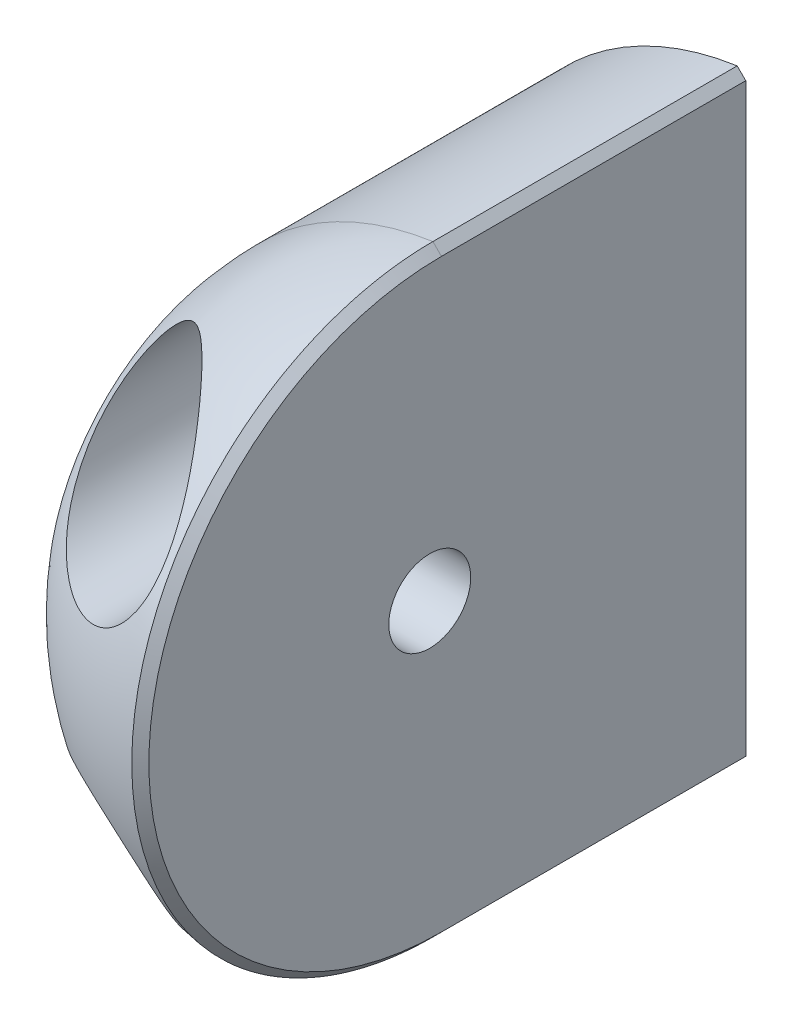
from build123d import *
from build123d.topology import SkipClean

# Parameters (mm, degrees)
REVOLU_O1_ANGLE            = 90
ESBO_O3_R                  = 2.5
CORTE_EXTRUS_O1_DEPTH      = 79.698792875
RESSALTO_EXTRUS_O1_START   = 13
ESBO_O7_R                  = 2.5
RESSALTO_EXTRUS_O1_DEPTH   = 13
CORTE_EXTRUS_O3_DEPTH      = 79.698792875
CORTE_EXTRUS_O3_DEPTH_BACK = 6.5
ESBO_O4_R                  = 3.5
ESBO_O6_R                  = 1.75
CORTE_EXTRUS_O4_DEPTH      = 71.924255371
CORTE_EXTRUS_O5_START      = -6.5
ESBO_O8_R                  = 3.1
CORTE_EXTRUS_O5_DEPTH      = 13
CHANFRO1_SIZE              = 2
CORTE_EXTRUS_O6_DEPTH      = 82.701335058
CORTE_EXTRUS_O7_DEPTH      = 81.405896153


with BuildPart() as part:
    # Esboço2 → Revolução1 (revolve)
    with BuildSketch(Plane.XY):
        with BuildLine():
            Line((-23.5, 42.5), (-23.5, 68.5))
            ThreePointArc((-23.5, 68.5), (-36.5, 55.5), (-23.5, 42.5))
        make_face()
    revolve(axis=Axis((-23.5, 42.5, 0), (0, 1, 0)), revolution_arc=REVOLU_O1_ANGLE)

    # Esboço3 → Corte-extrusão1 (cut, through all)
    with BuildSketch(Plane.XY):
        with Locations(Location((-29.2, 62, 0), (0, 0, 142.736397609))):
            Circle(ESBO_O3_R)
        with Locations(Location((-29.2, 49, 0), (0, 0, 233.94500715))):
            Circle(ESBO_O3_R)
    extrude(amount=CORTE_EXTRUS_O1_DEPTH, mode=Mode.SUBTRACT)

    # Esboço7 → Ressalto-extrusão1 (add)
    with SkipClean():  # the faces are left unmerged after this step: merging them gives an invalid solid
        with BuildSketch(Plane(origin=(0, 0, 0), x_dir=(-1, 0, 0), z_dir=(0, 0, -1)).offset(RESSALTO_EXTRUS_O1_START)):
            with BuildLine():
                Line((23.5, 68.5), (23.5, 42.5))
                ThreePointArc((23.5, 42.5), (36.5, 55.5), (23.5, 68.5))
            make_face()
            with Locations((29.2, 62)):
                Circle(ESBO_O7_R, mode=Mode.SUBTRACT)
            with Locations((29.2, 49)):
                Circle(ESBO_O7_R, mode=Mode.SUBTRACT)
        extrude(amount=-RESSALTO_EXTRUS_O1_DEPTH)

    # Esboço4 → Corte-extrusão3 (cut, two sides: drawn at the far end of the back side and taken through both)
    with BuildSketch(Plane.XY.offset(-CORTE_EXTRUS_O3_DEPTH_BACK)):
        with Locations((-29.2, 62)):
            Circle(ESBO_O4_R)
        with Locations((-29.2, 49)):
            Circle(ESBO_O4_R)
    extrude(amount=CORTE_EXTRUS_O3_DEPTH + CORTE_EXTRUS_O3_DEPTH_BACK, mode=Mode.SUBTRACT)

    # Esboço6 → Corte-extrusão4 (cut, through all)
    with BuildSketch(Plane(origin=(-23.5, 0, 0), x_dir=(0, 0, -1), z_dir=(1, 0, 0))):
        with Locations((-0.5, 55.5)):
            Circle(ESBO_O6_R)
    extrude(amount=-CORTE_EXTRUS_O4_DEPTH, mode=Mode.SUBTRACT)

    # Esboço8 → Corte-extrusão5 (cut)
    with BuildSketch(Plane(origin=(-23.5, 0, 0), x_dir=(0, 0, -1), z_dir=(1, 0, 0)).offset(CORTE_EXTRUS_O5_START)):
        with Locations(Location((-0.5, 55.5, 0), (0, 0, 279.281799091))):
            Circle(ESBO_O8_R)
    extrude(amount=-CORTE_EXTRUS_O5_DEPTH, mode=Mode.SUBTRACT)

    # Chanfro1
    # the kernel refuses this chamfer: 2 mm, written as the material it takes off along each edge
    with BuildSketch(Plane(origin=(-23.5, 42.5, -18.143365976), x_dir=(-0.9974093352150653, 0.07193481789677074, 0), z_dir=(0, 0, 1))) as chanfro1_piece_1:
        with BuildLine():
            Line((1.870305265, 0), (CHANFRO1_SIZE * 0.0719348178968, -CHANFRO1_SIZE * 0.997409335215))
            Line((CHANFRO1_SIZE * 0.0719348178968, -CHANFRO1_SIZE * 0.997409335215), (0, 0))
            ThreePointArc((0, 0), (0.961335866, 0.033652274), (1.870305265, 0))
        make_face()
    extrude(amount=18.143365976, mode=Mode.SUBTRACT)
    with BuildSketch(Plane(origin=(-23.5, 68.5, -18.143365976), x_dir=(-0.9974093352150653, -0.07193481789677116, 0), z_dir=(0, 0, 1))) as chanfro1_piece_2:
        with BuildLine():
            Line((1.870305265, 0), (CHANFRO1_SIZE * 0.0719348178968, CHANFRO1_SIZE * 0.997409335215))
            Line((CHANFRO1_SIZE * 0.0719348178968, CHANFRO1_SIZE * 0.997409335215), (0, 0))
            ThreePointArc((0, 0), (0.961335866, -0.033652274), (1.870305265, 0))
        make_face()
    extrude(amount=18.143365976, mode=Mode.SUBTRACT)
    with BuildSketch(Plane(origin=(-23.5, 55.5, 0), x_dir=(0, 1, 0), z_dir=(0, 0, -1))) as chanfro1_piece_3:
        with BuildLine():
            Line((12.865459931, -1.865459931), (13 - CHANFRO1_SIZE, 0))
            Line((13 - CHANFRO1_SIZE, 0), (13, 0))
            ThreePointArc((13, 0), (12.964411572, -0.961266138), (12.865459931, -1.865459931))
        make_face()
    revolve(axis=Axis((-23.5, 55.5, 0), (1, 0, 0)), revolution_arc=180, mode=Mode.SUBTRACT)

    # Esboço9 → Corte-extrusão6 (cut, through all)
    with BuildSketch(Plane(origin=(0, 0, -13), x_dir=(-1, 0, 0), z_dir=(0, 0, -1))):
        with BuildLine():
            Line((33.5, 47.193376137), (33.5, 63.806623863))
            ThreePointArc((33.5, 63.806623863), (36.5, 55.5), (33.5, 47.193376137))
        make_face()
    extrude(amount=-CORTE_EXTRUS_O6_DEPTH, mode=Mode.SUBTRACT)

    # Esboço10 → Corte-extrusão7 (cut, through all)
    with BuildSketch(Plane(origin=(0, 0, -13), x_dir=(-1, 0, 0), z_dir=(0, 0, -1))):
        Polygon((25, 68), (25, 43), (23.5, 44.5), (23.5, 66.5), align=None)
    extrude(amount=-CORTE_EXTRUS_O7_DEPTH, mode=Mode.SUBTRACT)


solid = part.part
